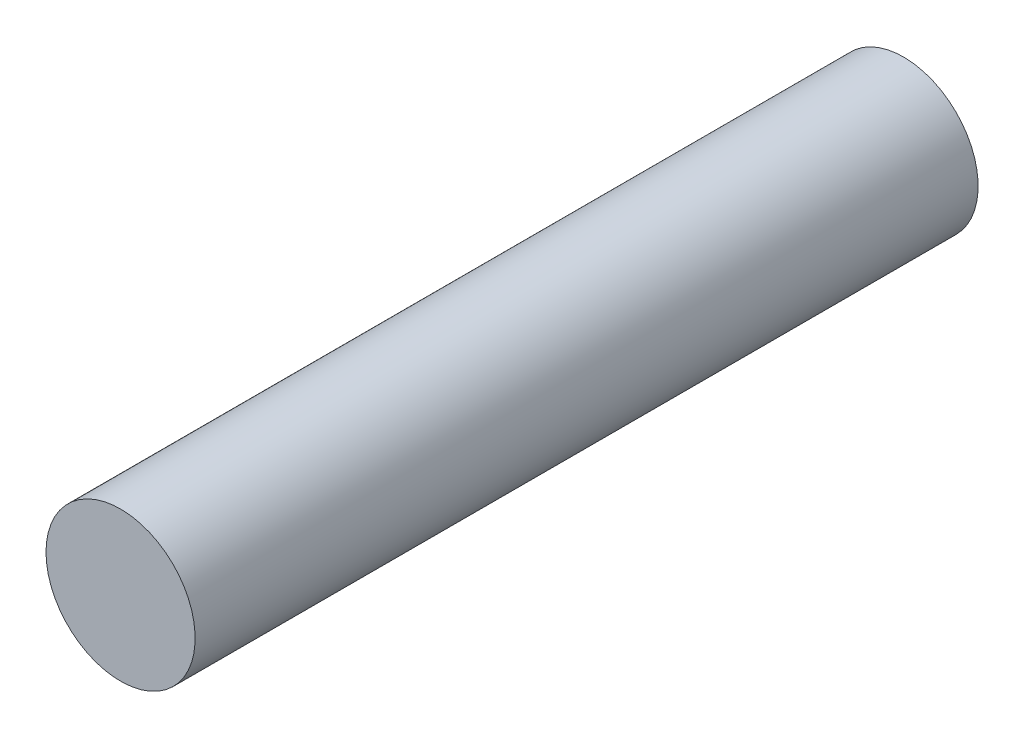
from build123d import *

# Parameters (mm, degrees)
SKETCH1_R           = 4
BOSS_EXTRUDE1_DEPTH = 21


with BuildPart() as part:
    # Sketch1 → Boss-Extrude1 (new, symmetric)
    with BuildSketch(Plane.XY):
        Circle(SKETCH1_R)
    extrude(amount=BOSS_EXTRUDE1_DEPTH, both=True)


solid = part.part
